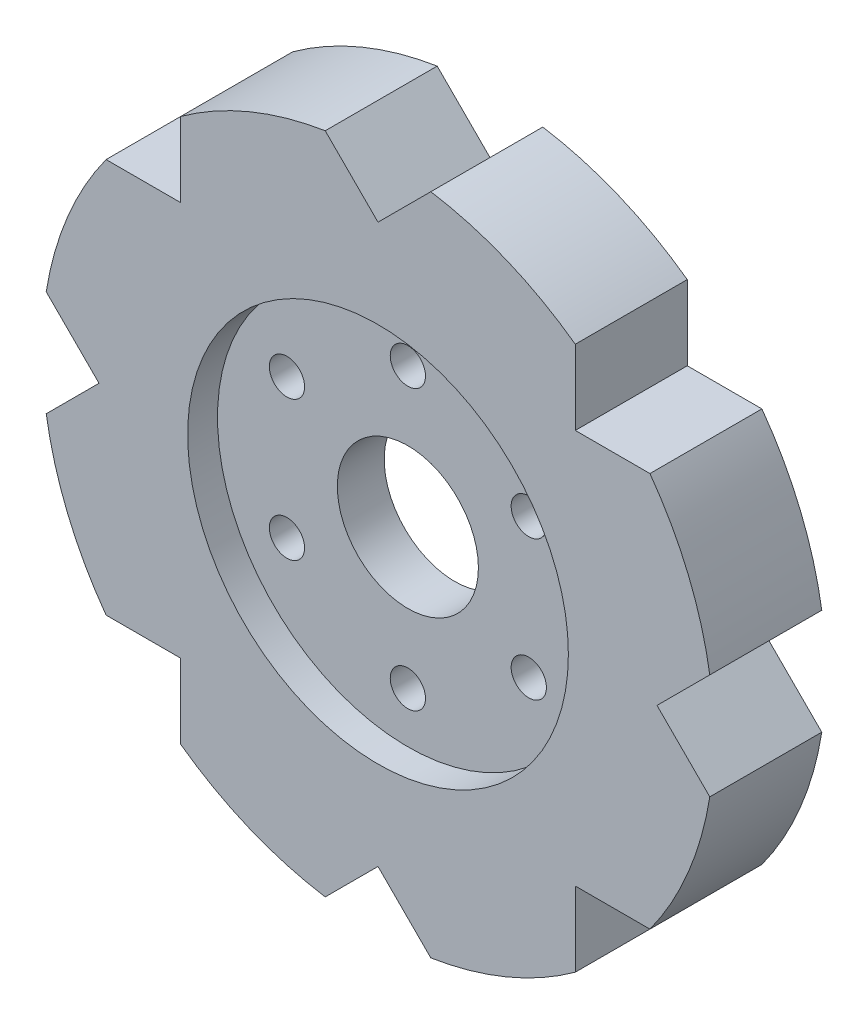
from build123d import *

# Parameters (mm, degrees)
BOSS_EXTRUDE1_DEPTH   = 19.05
SKETCH2_R             = 12
CUT_EXTRUDE1_DEPTH    = 83.060084694
SKETCH3_R             = 32.385
CUT_EXTRUDE2_DEPTH    = 5.08
SKETCH4_R             = 28.4
CUT_EXTRUDE3_DEPTH    = 6
F_6_0MM_DOWEL_HOLE1_D = 6


with BuildPart() as part:
    # Sketch1 → Boss-Extrude1 (new body)
    with BuildSketch(Plane.XY):
        with BuildLine():
            Line((-8.980256121, 56.44003455), (0, 47.459778429))
            Line((0, 47.459778429), (8.980256121, 56.44003455))
            ThreePointArc((8.980256121, 56.44003455), (21.87035816, 52.799715283), (33.559131161, 46.259131161))
            Line((33.559131161, 46.259131161), (33.559131161, 33.559131161))
            Line((33.559131161, 33.559131161), (46.259131161, 33.559131161))
            ThreePointArc((46.259131161, 33.559131161), (52.799715283, 21.87035816), (56.44003455, 8.980256121))
            Line((56.44003455, 8.980256121), (47.459778429, 0))
            Line((47.459778429, 0), (56.44003455, -8.980256121))
            ThreePointArc((56.44003455, -8.980256121), (52.799715283, -21.87035816), (46.259131161, -33.559131161))
            Line((46.259131161, -33.559131161), (33.559131161, -33.559131161))
            Line((33.559131161, -33.559131161), (33.559131161, -46.259131161))
            ThreePointArc((33.559131161, -46.259131161), (21.87035816, -52.799715283), (8.980256121, -56.44003455))
            Line((8.980256121, -56.44003455), (0, -47.459778429))
            Line((0, -47.459778429), (-8.980256121, -56.44003455))
            ThreePointArc((-8.980256121, -56.44003455), (-21.87035816, -52.799715283), (-33.559131161, -46.259131161))
            Line((-33.559131161, -46.259131161), (-33.559131161, -33.559131161))
            Line((-33.559131161, -33.559131161), (-46.259131161, -33.559131161))
            ThreePointArc((-46.259131161, -33.559131161), (-52.799715283, -21.87035816), (-56.44003455, -8.980256121))
            Line((-56.44003455, -8.980256121), (-47.459778429, 0))
            Line((-47.459778429, 0), (-56.44003455, 8.980256121))
            ThreePointArc((-56.44003455, 8.980256121), (-52.799715283, 21.87035816), (-46.259131161, 33.559131161))
            Line((-46.259131161, 33.559131161), (-33.559131161, 33.559131161))
            Line((-33.559131161, 33.559131161), (-33.559131161, 46.259131161))
            ThreePointArc((-33.559131161, 46.259131161), (-21.87035816, 52.799715283), (-8.980256121, 56.44003455))
        make_face()
    extrude(amount=BOSS_EXTRUDE1_DEPTH)

    # Sketch2 → Cut-Extrude1 (cut, through all)
    with BuildSketch(Plane.XY.offset(19.05)):
        Circle(SKETCH2_R)
    extrude(amount=-CUT_EXTRUDE1_DEPTH, mode=Mode.SUBTRACT)

    # Sketch3 → Cut-Extrude2 (cut)
    with BuildSketch(Plane.XY.offset(19.05)):
        Circle(SKETCH3_R)
    extrude(amount=-CUT_EXTRUDE2_DEPTH, mode=Mode.SUBTRACT)

    # Sketch4 → Cut-Extrude3 (cut)
    with BuildSketch(Plane(origin=(0, 0, 0), x_dir=(-1, 0, 0), z_dir=(0, 0, -1))):
        Circle(SKETCH4_R)
    extrude(amount=-CUT_EXTRUDE3_DEPTH, mode=Mode.SUBTRACT)

    # Ø6.0mm Dowel Hole1 (through all)
    with Locations(Plane(origin=(0, 0, 6), x_dir=(-1, 0, 0), z_dir=(0, 0, -1))):
        with Locations((0, 23.75), (20.56810334, 11.875), (20.56810334, -11.875), (0, -23.75), (-20.56810334, 11.875), (-20.56810334, -11.875)):
            Hole(F_6_0MM_DOWEL_HOLE1_D / 2)


solid = part.part
